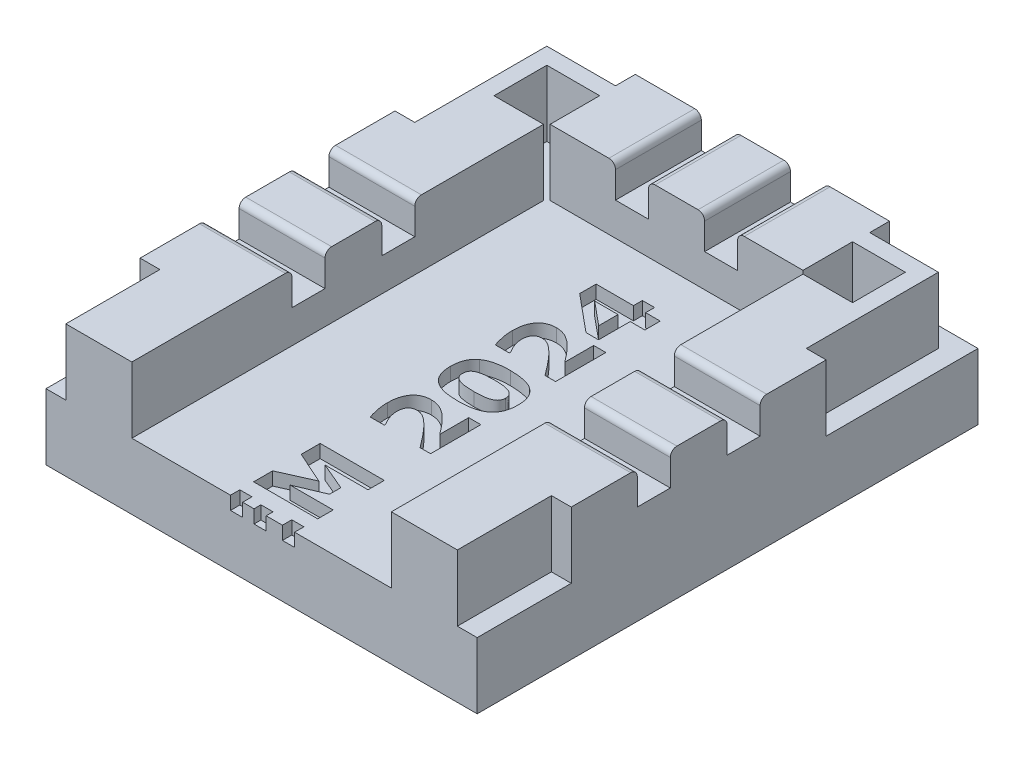
from build123d import *

# Parameters (mm, degrees)
SKETCH1_W                                  = 240
SKETCH1_H                                  = 200
BOSS_EXTRUDE1_DEPTH                        = 20
SKETCH7_W                                  = 120
SKETCH7_H                                  = 50
BOSS_EXTRUDE6_DEPTH                        = 20
FILLET1_R                                  = 2
SKETCH2_W                                  = 39.3
SKETCH2_H                                  = 125.7
CUT_EXTRUDE1_DEPTH                         = 10
CUT_EXTRUDE3_DEPTH                         = 5
MIRROR4_AT_THE_SECOND_PLANE_COPY_1_DEPTH   = 5
SKETCH11_W                                 = 104.748042719
SKETCH11_H                                 = 5
CUT_EXTRUDE4_DEPTH                         = 5
MIRROR6_AT_THE_SECOND_PLANE_COPY_1_SKETC_W = 104.748042719
MIRROR6_AT_THE_SECOND_PLANE_COPY_1_SKETC_H = 5
MIRROR6_AT_THE_SECOND_PLANE_COPY_1_DEPTH   = 5
SHELL1_START                               = 10
SHELL1_OUTLINE_W                           = 80.35
SHELL1_OUTLINE_H                           = 28.5
SHELL1_DEPTH                               = 10
FILLET3_R                                  = 1
SKETCH13_W                                 = 7.252545243
SKETCH13_H                                 = 2.335565418
SKETCH13_W_2                               = 1.720942939
SKETCH13_H_2                               = 2.581414408
CUT_EXTRUDE5_DEPTH                         = 2
CUT_EXTRUDE6_DEPTH                         = 10
MIRROR7_AT_THE_SECOND_PLANE_COPY_1_DEPTH   = 10
SKETCH15_W                                 = 101.789001661
SKETCH15_H                                 = 87.14110882
CUT_EXTRUDE7_DEPTH                         = 194.132079158
SKETCH16_W                                 = 296.201154453
SKETCH16_H                                 = 328.833485028
SKETCH16_W_2                               = 65.3
SKETCH16_H_2                               = 151.7
CUT_EXTRUDE10_DEPTH                        = 194.132079158
SKETCH17_W                                 = 70.628428311
SKETCH17_H                                 = 22.805656891
CUT_EXTRUDE12_DEPTH                        = 85.966140315


# Read off the part's stored shape, not the designer's step: Shell1
with BuildPart() as part:
    # Sketch1 → Boss-Extrude1 (new body)
    with BuildSketch(Plane(origin=(0, 0, 0), x_dir=(1, 0, 0), z_dir=(0, 1, 0))):
        Rectangle(SKETCH1_W, SKETCH1_H)
    extrude(amount=BOSS_EXTRUDE1_DEPTH)

    # Sketch7 → Boss-Extrude6 (add)
    with BuildSketch(Plane(origin=(0, 0, 0), x_dir=(1, 0, 0), z_dir=(0, 1, 0))):
        with Locations((0, 125)):
            Rectangle(SKETCH7_W, SKETCH7_H)
        with Locations((0, -125)):
            Rectangle(SKETCH7_W, SKETCH7_H)
    extrude(amount=BOSS_EXTRUDE6_DEPTH)

    # Fillet1
    fillet1_edges = [part.edges().sort_by_distance(p)[0] for p in [
        (-120, 20, 0),
        (90, 20, 100),
        (-90, 20, 100),
        (-60, 10, 150),
        (60, 10, 150),
        (-60, 20, 125),
        (0, 20, 150),
        (60, 20, 125),
        (-90, 20, -100),
        (60, 20, -125),
        (0, 20, -150),
        (60, 10, -150),
        (-60, 10, -150),
        (-60, 20, -125),
        (120, 20, 0),
        (120, 10, 100),
        (-120, 10, 100),
        (-120, 10, -100),
        (120, 10, -100),
        (90, 20, -100),
    ]]
    fillet(fillet1_edges, radius=FILLET1_R)

    # Sketch2 → Cut-Extrude1 (cut)
    with BuildSketch(Plane(origin=(0, 20, 0), x_dir=(1, 0, 0), z_dir=(0, 1, 0))):
        Rectangle(SKETCH2_W, SKETCH2_H)
    extrude(amount=-CUT_EXTRUDE1_DEPTH, mode=Mode.SUBTRACT)

    # Sketch10 → Cut-Extrude3 (cut)
    with BuildSketch(Plane(origin=(0, 20, 0), x_dir=(1, 0, 0), z_dir=(0, 1, 0))):
        Polygon((-9.25, -40.5), (-9.25, -33.162899401), (-4.25, -33.162899401), (-4.25, -40.5), (-4.25, -156.832928994), (-9.25, -156.832928994), align=None)
    cut_extrude3 = extrude(amount=-CUT_EXTRUDE3_DEPTH, mode=Mode.SUBTRACT)

    # Mirror4: Cut-Extrude3 across plane
    add(cut_extrude3.mirror(Plane(origin=(0, 0, 0), x_dir=(0, 0, 1), z_dir=(1, 0, 0))), mode=Mode.SUBTRACT)

    # Mirror4 at the second plane: Cut-Extrude3 across plane
    add(cut_extrude3.mirror(Plane.XY), mode=Mode.SUBTRACT)

    # Mirror4 at the second plane copy 1 sketc → Mirror4 at the second plane copy 1 (cut)
    with BuildSketch(Plane(origin=(0, 20, 0), x_dir=(-1, 0, 0), z_dir=(0, 1, 0))):
        Polygon((-9.25, -40.5), (-9.25, -33.162899401), (-4.25, -33.162899401), (-4.25, -40.5), (-4.25, -156.832928994), (-9.25, -156.832928994), align=None)
    extrude(amount=-MIRROR4_AT_THE_SECOND_PLANE_COPY_1_DEPTH, mode=Mode.SUBTRACT)

    # Sketch11 → Cut-Extrude4 (cut)
    with BuildSketch(Plane(origin=(0, 20, 0), x_dir=(1, 0, 0), z_dir=(0, 1, 0))):
        with Locations((-72.024021359, 26.75)):
            Rectangle(SKETCH11_W, SKETCH11_H)
        with Locations((-72.024021359, 40.35)):
            Rectangle(SKETCH11_W, SKETCH11_H)
    cut_extrude4 = extrude(amount=-CUT_EXTRUDE4_DEPTH, mode=Mode.SUBTRACT)

    # Mirror6: Cut-Extrude4 across plane
    add(cut_extrude4.mirror(Plane.XY), mode=Mode.SUBTRACT)

    # Mirror6 at the second plane: Cut-Extrude4 across plane
    add(cut_extrude4.mirror(Plane(origin=(0, 0, 0), x_dir=(0, 0, 1), z_dir=(1, 0, 0))), mode=Mode.SUBTRACT)

    # Mirror6 at the second plane copy 1 sketc → Mirror6 at the second plane copy 1 (cut)
    with BuildSketch(Plane(origin=(0, 20, 0), x_dir=(-1, 0, 0), z_dir=(0, 1, 0))):
        with Locations((-72.024021359, 26.75)):
            Rectangle(MIRROR6_AT_THE_SECOND_PLANE_COPY_1_SKETC_W, MIRROR6_AT_THE_SECOND_PLANE_COPY_1_SKETC_H)
        with Locations((-72.024021359, 40.35)):
            Rectangle(MIRROR6_AT_THE_SECOND_PLANE_COPY_1_SKETC_W, MIRROR6_AT_THE_SECOND_PLANE_COPY_1_SKETC_H)
    extrude(amount=-MIRROR6_AT_THE_SECOND_PLANE_COPY_1_DEPTH, mode=Mode.SUBTRACT)

    # Shell1 outline → Shell1 (cut)
    with BuildSketch(Plane(origin=(0, 0, 0), x_dir=(1, 0, 0), z_dir=(0, 1, 0)).offset(SHELL1_START)):
        Polygon((-29.65, 72.85), (-19.25, 72.85), (-19.25, 140), (-50, 140), (-50, 90), (-110, 90), (-110, 52.85), (-29.65, 52.85), align=None)
        Polygon((19.25, 72.85), (29.65, 72.85), (29.65, 52.85), (110, 52.85), (110, 90), (50, 90), (50, 140), (19.25, 140), align=None)
        Polygon((-110, -52.85), (-110, -90), (-50, -90), (-50, -140), (-19.25, -140), (-19.25, -72.85), (-29.65, -72.85), (-29.65, -52.85), align=None)
        with Locations((-69.825, 0)):
            Rectangle(SHELL1_OUTLINE_W, SHELL1_OUTLINE_H)
        Polygon((29.65, -72.85), (19.25, -72.85), (19.25, -140), (50, -140), (50, -90), (110, -90), (110, -52.85), (29.65, -52.85), align=None)
        with Locations((69.825, 0)):
            Rectangle(SHELL1_OUTLINE_W, SHELL1_OUTLINE_H)
    extrude(amount=SHELL1_DEPTH, mode=Mode.SUBTRACT)

    # Fillet3
    fillet3_edges = [part.edges().sort_by_distance(p)[0] for p in [
        (-4.25, 16.5, 150),
        (-4.25, 19.414213562, 149.414213562),
        (-9.25, 16.5, 150),
        (-9.25, 19.414213562, 149.414213562),
        (-4.25, 20, 105.425),
        (-9.25, 20, 105.425),
        (-9.25, 19.414213562, -149.414213562),
        (-9.25, 16.5, -150),
        (-9.25, 20, -105.425),
        (-4.25, 16.5, -150),
        (-4.25, 19.414213562, -149.414213562),
        (-4.25, 20, -105.425),
        (9.25, 16.5, 150),
        (9.25, 20, 105.425),
        (9.25, 19.414213562, 149.414213562),
        (4.25, 16.5, 150),
        (4.25, 19.414213562, 149.414213562),
        (4.25, 20, 105.425),
        (4.25, 16.5, -150),
        (4.25, 19.414213562, -149.414213562),
        (9.25, 19.414213562, -149.414213562),
        (9.25, 16.5, -150),
        (4.25, 20, -105.425),
        (9.25, 20, -105.425),
        (-120, 16.5, -24.25),
        (-120, 16.5, -29.25),
        (-119.414213562, 19.414213562, -24.25),
        (-119.414213562, 19.414213562, -29.25),
        (-68.825, 20, -24.25),
        (-68.825, 20, -29.25),
        (-120, 16.5, -37.85),
        (-120, 16.5, -42.85),
        (-68.825, 20, -37.85),
        (-68.825, 20, -42.85),
        (-119.414213562, 19.414213562, -37.85),
        (-119.414213562, 19.414213562, -42.85),
        (68.825, 20, -29.25),
        (119.414213562, 19.414213562, -29.25),
        (119.414213562, 19.414213562, -24.25),
        (68.825, 20, -24.25),
        (120, 16.5, -29.25),
        (120, 16.5, -24.25),
        (68.825, 20, -42.85),
        (119.414213562, 19.414213562, -42.85),
        (119.414213562, 19.414213562, -37.85),
        (68.825, 20, -37.85),
        (120, 16.5, -42.85),
        (120, 16.5, -37.85),
        (-120, 16.5, 29.25),
        (-120, 16.5, 24.25),
        (-68.825, 20, 29.25),
        (-119.414213562, 19.414213562, 29.25),
        (-119.414213562, 19.414213562, 24.25),
        (-68.825, 20, 24.25),
        (-120, 16.5, 42.85),
        (-120, 16.5, 37.85),
        (-68.825, 20, 42.85),
        (-119.414213562, 19.414213562, 42.85),
        (-119.414213562, 19.414213562, 37.85),
        (-68.825, 20, 37.85),
        (120, 16.5, 24.25),
        (120, 16.5, 29.25),
        (119.414213562, 19.414213562, 24.25),
        (119.414213562, 19.414213562, 29.25),
        (68.825, 20, 24.25),
        (68.825, 20, 29.25),
        (120, 16.5, 37.85),
        (120, 16.5, 42.85),
        (68.825, 20, 37.85),
        (68.825, 20, 42.85),
        (119.414213562, 19.414213562, 37.85),
        (119.414213562, 19.414213562, 42.85),
    ]]
    fillet(fillet3_edges, radius=FILLET3_R)

    # Sketch13 → Cut-Extrude5 (cut)
    # profile 1 of 12: a face of its own
    with BuildSketch(Plane(origin=(0, 10, 0), x_dir=(1, 0, 0), z_dir=(0, 1, 0))):
        Polygon((2.787359078, 56.729654742), (2.787359078, 55.37748529), (5, 55.37748529), (5, 53.041919872), (2.787359078, 53.041919872), (2.787359078, 48.247864542), (0.880108701, 48.247864542), (-4.711035156, 52.886343558), (-4.711035156, 55.37748529), (0.943491644, 55.37748529), (0.943491644, 56.729654742), align=None)
        Polygon((0.943491644, 53.041919872), (-2.596349692, 53.041919872), (0.943491644, 50.110938929), align=None, mode=Mode.SUBTRACT)
    # profile 2 of 12: a face of its own
    with BuildSketch(Plane(origin=(0, 10, 0), x_dir=(1, 0, 0), z_dir=(0, 1, 0))):
        with BuildLine():
            Line((5, 47.141544081), (5, 39.520225351))
            Line((5, 39.520225351), (3.409664338, 39.520225351))
            add(Edge.make_bspline(
                [(3.409664338, 39.520225351), (3.190599668, 39.81675512), (2.747057383, 40.417141716), (2.167094132, 41.14339637), (1.704390868, 41.703253096), (1.381972101, 42.083056551), (1.083256561, 42.417759603), (0.887687077, 42.622007507), (0.79559811, 42.718182933)],
                knots=[0, 0, 0, 0, 1.605452287, 3.25057426, 4.046675402, 4.768563423, 5.420146126, 6, 6, 6, 6], degree=3))
            add(Edge.make_bspline(
                [(0.79559811, 42.718182933), (0.732570292, 42.782561984), (0.609352585, 42.908421315), (0.423765416, 43.085974145), (0.244476812, 43.249198615), (0.074088064, 43.400664381), (-0.092796487, 43.534082219), (-0.252790737, 43.654099684), (-0.406497488, 43.759962438), (-0.599845109, 43.881290453), (-0.837875375, 44.00401532), (-1.125540586, 44.112139625), (-1.412736444, 44.178491494), (-1.604945873, 44.187117789), (-1.699385013, 44.191356186)],
                knots=[0, 0, 0, 0, 1.090093853, 2.131104457, 3.107135244, 4.023908394, 4.888948297, 5.691514549, 6.4435893, 7.146498757, 8.452673016, 9.675803408, 10.85804184, 12, 12, 12, 12], degree=3))
            add(Edge.make_bspline(
                [(-1.699385013, 44.191356186), (-1.754483363, 44.189605987), (-1.861179083, 44.186216799), (-2.017224671, 44.167846758), (-2.162681909, 44.132103765), (-2.300488192, 44.087839319), (-2.42643972, 44.024206924), (-2.544199113, 43.950411254), (-2.650531499, 43.859818439), (-2.749307162, 43.758726543), (-2.834556733, 43.642742478), (-2.911599654, 43.517157005), (-2.971430142, 43.377241787), (-3.024398474, 43.226819474), (-3.063653395, 43.063897589), (-3.092633036, 42.889340485), (-3.109905835, 42.703165878), (-3.111960528, 42.574807759), (-3.113016713, 42.508827152)],
                knots=[0, 0, 0, 0, 1.058578686, 2.049894692, 3.010224385, 3.931750511, 4.822578239, 5.71281177, 6.594427321, 7.498813824, 8.420995957, 9.353043897, 10.321837571, 11.3367408, 12.413304787, 13.535187771, 14.732999458, 16, 16, 16, 16], degree=3))
            add(Edge.make_bspline(
                [(-3.113016713, 42.508827152), (-3.110052719, 42.405568465), (-3.104041103, 42.196137688), (-3.053985994, 41.878413923), (-2.980602684, 41.552282773), (-2.873221808, 41.222921491), (-2.74714341, 40.895094854), (-2.596251992, 40.578640505), (-2.438170844, 40.269132893), (-2.314289691, 40.074405983), (-2.252545243, 39.977350819)],
                knots=[0, 0, 0, 0, 0.914703558, 1.855215137, 2.844920106, 3.875005138, 4.922433174, 5.955639304, 6.981056277, 8, 8, 8, 8], degree=3))
            Line((-2.252545243, 39.977350819), (-2.252545243, 39.766074342))
            Line((-2.252545243, 39.766074342), (-4.363389317, 39.766074342))
            add(Edge.make_bspline(
                [(-4.363389317, 39.766074342), (-4.396975153, 39.85152697), (-4.470639347, 40.038951181), (-4.568658946, 40.352153969), (-4.66491051, 40.720660415), (-4.763825821, 41.132864511), (-4.849735205, 41.573321973), (-4.910075419, 42.024211578), (-4.95119256, 42.474770211), (-4.954991729, 42.775713815), (-4.956884148, 42.92561802)],
                knots=[0, 0, 0, 0, 0.681686624, 1.495150967, 2.435076171, 3.509887788, 4.642826517, 5.765734475, 6.887081194, 8, 8, 8, 8], degree=3))
            add(Edge.make_bspline(
                [(-4.956884148, 42.92561802), (-4.954912362, 43.072306092), (-4.951074185, 43.357841566), (-4.914531776, 43.772464491), (-4.853049644, 44.160650299), (-4.769612134, 44.521836328), (-4.662431161, 44.856562797), (-4.529987596, 45.163893905), (-4.371768891, 45.443672956), (-4.191325, 45.69718541), (-3.986517109, 45.920499957), (-3.762299213, 46.116633841), (-3.516918106, 46.283180062), (-3.250583577, 46.417510178), (-2.964907945, 46.521931142), (-2.659732708, 46.596780352), (-2.333869778, 46.641015432), (-2.109911454, 46.646854566), (-1.995172081, 46.649846099)],
                knots=[0, 0, 0, 0, 1.302669921, 2.535710425, 3.693104205, 4.791067539, 5.825099944, 6.810730835, 7.758000335, 8.67487823, 9.568447078, 10.443087854, 11.315285082, 12.19521531, 13.085757283, 14.011200708, 14.981089066, 16, 16, 16, 16], degree=3))
            add(Edge.make_bspline(
                [(-1.995172081, 46.649846099), (-1.918295051, 46.648245135), (-1.764899121, 46.645050664), (-1.536586701, 46.623146341), (-1.311198259, 46.589276583), (-1.089189633, 46.538876948), (-0.870129482, 46.472993238), (-0.653296175, 46.39436831), (-0.439122967, 46.302496277), (-0.229338943, 46.193054838), (-0.018163961, 46.072147599), (0.191952814, 45.932794317), (0.405837655, 45.781094454), (0.620958688, 45.614342324), (0.835471411, 45.430057751), (1.055741697, 45.23549192), (1.273520634, 45.021368665), (1.417594688, 44.872241147), (1.490889788, 44.796375188)],
                knots=[0, 0, 0, 0, 0.907170522, 1.810115022, 2.704515666, 3.595334857, 4.494160497, 5.402400165, 6.316123003, 7.242010315, 8.19323076, 9.186549597, 10.215937183, 11.28746875, 12.397107329, 13.552885457, 14.755074217, 16, 16, 16, 16], degree=3))
            add(Edge.make_bspline(
                [(1.490889788, 44.796375188), (1.669671754, 44.600991906), (2.021428479, 44.216571794), (2.422503942, 43.720261203), (2.710127438, 43.347225494), (2.892573427, 43.11547907), (3.035611297, 42.923413887), (3.11966375, 42.809753418), (3.156132565, 42.760438229)],
                knots=[0, 0, 0, 0, 1.811045763, 3.563265038, 4.362127914, 5.033096026, 5.580478129, 6, 6, 6, 6], degree=3))
            Line((3.156132565, 42.760438229), (3.156132565, 47.141544081))
            Line((3.156132565, 47.141544081), (5, 47.141544081))
        make_face()
    # profile 3 of 12: a face of its own
    with BuildSketch(Plane(origin=(0, 10, 0), x_dir=(1, 0, 0), z_dir=(0, 1, 0))):
        with BuildLine():
            add(Edge.make_bspline(
                [(0.138720336, 37.553433421), (0.339837036, 37.551198694), (0.731017162, 37.546852061), (1.301575539, 37.503210957), (1.839727263, 37.435290008), (2.344336806, 37.340402007), (2.812295891, 37.218717557), (3.235819492, 37.059739443), (3.620265586, 36.877229499), (3.845547684, 36.720963882), (3.955141787, 36.64494457)],
                knots=[0, 0, 0, 0, 1.210994604, 2.355433537, 3.443919748, 4.476135166, 5.446013627, 6.351277171, 7.197937607, 8, 8, 8, 8], degree=3))
            add(Edge.make_bspline(
                [(3.955141787, 36.64494457), (4.057367971, 36.5617232), (4.260610648, 36.396265258), (4.524020765, 36.101981434), (4.745368417, 35.772676286), (4.897303004, 35.472877401), (4.999247268, 35.217133399), (5.063592063, 35.011802969), (5.122267484, 34.796985151), (5.167723638, 34.570405454), (5.201934481, 34.333084121), (5.226664862, 34.085073274), (5.242295446, 33.825562266), (5.244648027, 33.648682389), (5.245848991, 33.558387312)],
                knots=[0, 0, 0, 0, 1.363120718, 2.710110989, 4.070537742, 5.460816644, 6.180869889, 6.918733188, 7.687278466, 8.485437086, 9.309407483, 10.168795045, 11.065191617, 12, 12, 12, 12], degree=3))
            add(Edge.make_bspline(
                [(5.245848991, 33.558387312), (5.241905689, 33.384062955), (5.234297073, 33.047703496), (5.173081199, 32.562988904), (5.069699732, 32.118069919), (4.926806373, 31.711596248), (4.739854178, 31.34454147), (4.516760058, 31.013155063), (4.251279595, 30.717979546), (4.045332533, 30.554230832), (3.94169692, 30.471830054)],
                knots=[0, 0, 0, 0, 1.200851745, 2.317047666, 3.359233085, 4.342911255, 5.278031965, 6.189548012, 7.088953741, 8, 8, 8, 8], degree=3))
            add(Edge.make_bspline(
                [(3.94169692, 30.471830054), (3.829424185, 30.3947628), (3.600170882, 30.2373967), (3.214838014, 30.049115343), (2.792701976, 29.89168932), (2.331256748, 29.768085058), (1.834031119, 29.675388633), (1.301418942, 29.61187027), (0.734794995, 29.570336966), (0.344952566, 29.565716964), (0.144482422, 29.563341204)],
                knots=[0, 0, 0, 0, 0.822750793, 1.680001256, 2.58557045, 3.544707477, 4.565467581, 5.642347189, 6.787615291, 8, 8, 8, 8], degree=3))
            add(Edge.make_bspline(
                [(0.144482422, 29.563341204), (-0.061754837, 29.565532126), (-0.459970452, 29.569762495), (-1.036345286, 29.613069323), (-1.570746564, 29.680774054), (-2.065452333, 29.775711056), (-2.521358164, 29.900947264), (-2.938473361, 30.06222162), (-3.323134476, 30.249194002), (-3.55325365, 30.406272972), (-3.666176943, 30.483354226)],
                knots=[0, 0, 0, 0, 1.242237956, 2.39858964, 3.479780431, 4.485821505, 5.430991799, 6.32348679, 7.177307181, 8, 8, 8, 8], degree=3))
            add(Edge.make_bspline(
                [(-3.666176943, 30.483354226), (-3.769193286, 30.566416838), (-3.974708441, 30.732124775), (-4.238285133, 31.029639616), (-4.461065672, 31.362253167), (-4.645070962, 31.729678272), (-4.784115122, 32.135791847), (-4.885860052, 32.577168574), (-4.944671996, 33.056148657), (-4.952723667, 33.387282789), (-4.956884148, 33.558387312)],
                knots=[0, 0, 0, 0, 0.915406887, 1.826214983, 2.74012738, 3.682217607, 4.664024873, 5.706462388, 6.814877053, 8, 8, 8, 8], degree=3))
            add(Edge.make_bspline(
                [(-4.956884148, 33.558387312), (-4.955682618, 33.64868302), (-4.953320425, 33.826203271), (-4.937576888, 34.086978277), (-4.913381513, 34.337057391), (-4.877300412, 34.575699285), (-4.828262853, 34.80214551), (-4.773499009, 35.018778584), (-4.706561244, 35.224310597), (-4.601886899, 35.480626422), (-4.447267393, 35.781827029), (-4.217150947, 36.109134402), (-3.948246131, 36.405401156), (-3.739143401, 36.569659884), (-3.633525124, 36.652627351)],
                knots=[0, 0, 0, 0, 0.927772364, 1.823989051, 2.683453821, 3.508702832, 4.302191287, 5.063276402, 5.803871599, 6.520953588, 7.906777029, 9.27188215, 10.622021304, 12, 12, 12, 12], degree=3))
            add(Edge.make_bspline(
                [(-3.633525124, 36.652627351), (-3.521300204, 36.729189524), (-3.292789343, 36.885084383), (-2.908970475, 37.068290297), (-2.492360426, 37.225455121), (-2.036263275, 37.346342452), (-1.54437137, 37.439204828), (-1.015826808, 37.505677425), (-0.450933502, 37.546286922), (-0.061742996, 37.551003841), (0.138720336, 37.553433421)],
                knots=[0, 0, 0, 0, 0.826423845, 1.682753026, 2.582377666, 3.535958882, 4.552416628, 5.629628825, 6.779074777, 8, 8, 8, 8], degree=3))
        make_face()
        with BuildLine():
            add(Edge.make_bspline(
                [(0.138720336, 35.094943508), (-0.002794049, 35.093990238), (-0.275052116, 35.092156251), (-0.667644343, 35.074004214), (-1.028464631, 35.048543297), (-1.357952356, 35.010483072), (-1.656192237, 34.961169576), (-1.923473104, 34.900935006), (-2.158488294, 34.828227196), (-2.363936988, 34.745989678), (-2.54162794, 34.64913888), (-2.69467252, 34.537908006), (-2.823572221, 34.410664927), (-2.931286275, 34.270097317), (-3.011274034, 34.111739825), (-3.072443859, 33.941187009), (-3.106785969, 33.754382189), (-3.110895684, 33.625106618), (-3.113016713, 33.558387312)],
                knots=[0, 0, 0, 0, 1.684598718, 3.240982106, 4.677870026, 5.990101975, 7.188004416, 8.275163324, 9.249099904, 10.113910365, 10.905306099, 11.652292794, 12.358339015, 13.054983843, 13.750418457, 14.461547751, 15.206002611, 16, 16, 16, 16], degree=3))
            add(Edge.make_bspline(
                [(-3.113016713, 33.558387312), (-3.110895681, 33.491668012), (-3.106785962, 33.362392453), (-3.072443884, 33.175587552), (-3.011273943, 33.005035023), (-2.931286606, 32.84667649), (-2.823570979, 32.706112772), (-2.694677343, 32.578854684), (-2.541608299, 32.467684345), (-2.363496496, 32.37029911), (-2.157013742, 32.289020864), (-1.921590867, 32.215742751), (-1.654258135, 32.155647372), (-1.355414385, 32.106122047), (-1.024612933, 32.068276855), (-0.661244964, 32.04269777), (-0.266085327, 32.024665897), (0.008090715, 32.022799039), (0.150244508, 32.021831116)],
                knots=[0, 0, 0, 0, 0.791766581, 1.534129826, 2.243261137, 2.936741863, 3.631429404, 4.335491923, 5.08037989, 5.869552125, 6.738971147, 7.710171362, 8.794275798, 9.988812621, 11.304907075, 12.745337551, 14.312534512, 16, 16, 16, 16], degree=3))
            add(Edge.make_bspline(
                [(0.150244508, 32.021831116), (0.289201434, 32.022765136), (0.556986265, 32.024565091), (0.943773412, 32.043063349), (1.30096878, 32.067483158), (1.627502144, 32.109075315), (1.924420257, 32.156514098), (2.190195476, 32.220950105), (2.427221865, 32.292197549), (2.635687527, 32.376524358), (2.816464841, 32.475577579), (2.974492505, 32.586386469), (3.106149375, 32.714997304), (3.215613674, 32.855867424), (3.298888327, 33.012083539), (3.358752163, 33.181622444), (3.396338685, 33.365314373), (3.400067537, 33.492898418), (3.401981557, 33.558387312)],
                knots=[0, 0, 0, 0, 1.658832269, 3.196746878, 4.622488866, 5.931787449, 7.125569234, 8.210133994, 9.194149195, 10.078471196, 10.889203548, 11.650697572, 12.375032472, 13.07829054, 13.77251817, 14.478471121, 15.218999177, 16, 16, 16, 16], degree=3))
            add(Edge.make_bspline(
                [(3.401981557, 33.558387312), (3.400068186, 33.623876875), (3.3963406, 33.751462223), (3.358745104, 33.935144911), (3.298913291, 34.10471679), (3.215521541, 34.260812329), (3.106775331, 34.40178813), (2.97377315, 34.528364287), (2.816557237, 34.639341559), (2.635707586, 34.738476019), (2.42683161, 34.821967534), (2.190341985, 34.897522561), (1.921851262, 34.956560743), (1.624132619, 35.009519497), (1.295502071, 35.045529443), (0.936895825, 35.074962985), (0.547988509, 35.091838226), (0.278306115, 35.093884415), (0.138720336, 35.094943508)],
                knots=[0, 0, 0, 0, 0.778971247, 1.517574904, 2.221693305, 2.914116855, 3.615547377, 4.332711038, 5.092226179, 5.900851692, 6.782875619, 7.766611013, 8.854037796, 10.053520173, 11.366075456, 12.788704916, 14.337855446, 16, 16, 16, 16], degree=3))
        make_face(mode=Mode.SUBTRACT)
    # profile 4 of 12: a face of its own
    with BuildSketch(Plane(origin=(0, 10, 0), x_dir=(1, 0, 0), z_dir=(0, 1, 0))):
        with BuildLine():
            Line((5, 28.211171751), (5, 20.589853021))
            Line((5, 20.589853021), (3.409664338, 20.589853021))
            add(Edge.make_bspline(
                [(3.409664338, 20.589853021), (3.190599668, 20.88638279), (2.747057383, 21.486769386), (2.167094132, 22.21302404), (1.704390868, 22.772880767), (1.381972101, 23.152684221), (1.083256561, 23.487387273), (0.887687077, 23.691635177), (0.79559811, 23.787810603)],
                knots=[0, 0, 0, 0, 1.605452287, 3.25057426, 4.046675402, 4.768563423, 5.420146126, 6, 6, 6, 6], degree=3))
            add(Edge.make_bspline(
                [(0.79559811, 23.787810603), (0.732570292, 23.852189654), (0.609352585, 23.978048985), (0.423765416, 24.155601815), (0.244476812, 24.318826285), (0.074088064, 24.470292051), (-0.092796487, 24.60370989), (-0.252790737, 24.723727355), (-0.406497488, 24.829590108), (-0.599845109, 24.950918123), (-0.837875375, 25.07364299), (-1.125540586, 25.181767295), (-1.412736444, 25.248119164), (-1.604945873, 25.256745459), (-1.699385013, 25.260983856)],
                knots=[0, 0, 0, 0, 1.090093853, 2.131104457, 3.107135244, 4.023908394, 4.888948297, 5.691514549, 6.4435893, 7.146498757, 8.452673016, 9.675803408, 10.85804184, 12, 12, 12, 12], degree=3))
            add(Edge.make_bspline(
                [(-1.699385013, 25.260983856), (-1.754483363, 25.259233658), (-1.861179083, 25.25584447), (-2.017224671, 25.237474428), (-2.162681909, 25.201731435), (-2.300488192, 25.157466989), (-2.42643972, 25.093834595), (-2.544199113, 25.020038924), (-2.650531499, 24.929446109), (-2.749307162, 24.828354213), (-2.834556733, 24.712370148), (-2.911599654, 24.586784675), (-2.971430142, 24.446869457), (-3.024398474, 24.296447144), (-3.063653395, 24.133525259), (-3.092633036, 23.958968155), (-3.109905835, 23.772793548), (-3.111960528, 23.644435429), (-3.113016713, 23.578454822)],
                knots=[0, 0, 0, 0, 1.058578686, 2.049894692, 3.010224385, 3.931750511, 4.822578239, 5.71281177, 6.594427321, 7.498813824, 8.420995957, 9.353043897, 10.321837571, 11.3367408, 12.413304787, 13.535187771, 14.732999458, 16, 16, 16, 16], degree=3))
            add(Edge.make_bspline(
                [(-3.113016713, 23.578454822), (-3.110052719, 23.475196136), (-3.104041103, 23.265765358), (-3.053985994, 22.948041593), (-2.980602684, 22.621910443), (-2.873221808, 22.292549161), (-2.74714341, 21.964722525), (-2.596251992, 21.648268175), (-2.438170844, 21.338760563), (-2.314289691, 21.144033653), (-2.252545243, 21.046978489)],
                knots=[0, 0, 0, 0, 0.914703558, 1.855215137, 2.844920106, 3.875005138, 4.922433174, 5.955639304, 6.981056277, 8, 8, 8, 8], degree=3))
            Line((-2.252545243, 21.046978489), (-2.252545243, 20.835702012))
            Line((-2.252545243, 20.835702012), (-4.363389317, 20.835702012))
            add(Edge.make_bspline(
                [(-4.363389317, 20.835702012), (-4.396975153, 20.92115464), (-4.470639347, 21.108578851), (-4.568658946, 21.421781639), (-4.66491051, 21.790288086), (-4.763825821, 22.202492181), (-4.849735205, 22.642949643), (-4.910075419, 23.093839248), (-4.95119256, 23.544397881), (-4.954991729, 23.845341485), (-4.956884148, 23.99524569)],
                knots=[0, 0, 0, 0, 0.681686624, 1.495150967, 2.435076171, 3.509887788, 4.642826517, 5.765734475, 6.887081194, 8, 8, 8, 8], degree=3))
            add(Edge.make_bspline(
                [(-4.956884148, 23.99524569), (-4.954912362, 24.141933762), (-4.951074185, 24.427469237), (-4.914531776, 24.842092162), (-4.853049644, 25.230277969), (-4.769612134, 25.591463998), (-4.662431161, 25.926190468), (-4.529987596, 26.233521576), (-4.371768891, 26.513300626), (-4.191325, 26.76681308), (-3.986517109, 26.990127627), (-3.762299213, 27.186261512), (-3.516918106, 27.352807733), (-3.250583577, 27.487137848), (-2.964907945, 27.591558812), (-2.659732708, 27.666408023), (-2.333869778, 27.710643103), (-2.109911454, 27.716482236), (-1.995172081, 27.719473769)],
                knots=[0, 0, 0, 0, 1.302669921, 2.535710425, 3.693104205, 4.791067539, 5.825099944, 6.810730835, 7.758000335, 8.67487823, 9.568447078, 10.443087854, 11.315285082, 12.19521531, 13.085757283, 14.011200708, 14.981089066, 16, 16, 16, 16], degree=3))
            add(Edge.make_bspline(
                [(-1.995172081, 27.719473769), (-1.918295051, 27.717872805), (-1.764899121, 27.714678334), (-1.536586701, 27.692774011), (-1.311198259, 27.658904253), (-1.089189633, 27.608504619), (-0.870129482, 27.542620908), (-0.653296175, 27.46399598), (-0.439122967, 27.372123947), (-0.229338943, 27.262682508), (-0.018163961, 27.141775269), (0.191952814, 27.002421987), (0.405837655, 26.850722124), (0.620958688, 26.683969994), (0.835471411, 26.499685422), (1.055741697, 26.30511959), (1.273520634, 26.090996335), (1.417594688, 25.941868817), (1.490889788, 25.866002858)],
                knots=[0, 0, 0, 0, 0.907170522, 1.810115022, 2.704515666, 3.595334857, 4.494160497, 5.402400165, 6.316123003, 7.242010315, 8.19323076, 9.186549597, 10.215937183, 11.28746875, 12.397107329, 13.552885457, 14.755074217, 16, 16, 16, 16], degree=3))
            add(Edge.make_bspline(
                [(1.490889788, 25.866002858), (1.669671754, 25.670619576), (2.021428479, 25.286199464), (2.422503942, 24.789888873), (2.710127438, 24.416853164), (2.892573427, 24.18510674), (3.035611297, 23.993041557), (3.11966375, 23.879381088), (3.156132565, 23.830065899)],
                knots=[0, 0, 0, 0, 1.811045763, 3.563265038, 4.362127914, 5.033096026, 5.580478129, 6, 6, 6, 6], degree=3))
            Line((3.156132565, 23.830065899), (3.156132565, 28.211171751))
            Line((3.156132565, 28.211171751), (5, 28.211171751))
        make_face()
    # profile 5 of 12: a face of its own
    with BuildSketch(Plane(origin=(0, 10, 0), x_dir=(1, 0, 0), z_dir=(0, 1, 0))):
        Polygon((5, 13.583156769), (5, 11.124666856), (-1.524601746, 11.124666856), (2.664434583, 9.338420279), (2.664434583, 7.625160121), (-1.524601746, 5.838913543), (5, 5.838913543), (5, 3.503348126), (-4.711035156, 3.503348126), (-4.711035156, 6.382470298), (0.125275469, 8.549014533), (-4.711035156, 10.709796683), (-4.711035156, 13.583156769), align=None)
    # profile 6 of 12: a face of its own
    with BuildSketch(Plane(origin=(0, 10, 0), x_dir=(1, 0, 0), z_dir=(0, 1, 0))):
        Polygon((5, 1.4136317), (5, -5.593064552), (-4.711035156, -5.593064552), (-4.711035156, 1.4136317), (-2.867167722, 1.4136317), (-2.867167722, -3.134574639), (-1.146224782, -3.134574639), (-1.146224782, 1.044858213), (0.697642652, 1.044858213), (0.697642652, -3.134574639), (3.156132565, -3.134574639), (3.156132565, 1.4136317), align=None)
    # profile 7 of 12: a face of its own
    with BuildSketch(Plane(origin=(0, 10, 0), x_dir=(1, 0, 0), z_dir=(0, 1, 0))):
        with BuildLine():
            add(Edge.make_bspline(
                [(4.475650198, -7.805705474), (4.519354839, -7.923859504), (4.612512661, -8.17570855), (4.743574124, -8.583890089), (4.866671289, -9.047274178), (4.996208031, -9.552124696), (5.106381276, -10.084227717), (5.187397941, -10.625264318), (5.237323662, -11.165972628), (5.243010567, -11.526628491), (5.245848991, -11.706637515)],
                knots=[0, 0, 0, 0, 0.756485239, 1.612472169, 2.573171414, 3.635272123, 4.742182008, 5.834553763, 6.919191659, 8, 8, 8, 8], degree=3))
            add(Edge.make_bspline(
                [(5.245848991, -11.706637515), (5.241962961, -11.909112321), (5.234392087, -12.303579456), (5.17063924, -12.878829296), (5.062937634, -13.419584917), (4.916847086, -13.928231287), (4.72267015, -14.400885619), (4.491042888, -14.842463027), (4.211679163, -15.247896521), (3.893490591, -15.618759753), (3.53655883, -15.9505899), (3.145758166, -16.239699566), (2.72146993, -16.48347792), (2.264846611, -16.681095463), (1.776896349, -16.838089964), (1.255150105, -16.944841813), (0.702111097, -17.014888699), (0.322052776, -17.021601157), (0.127196165, -17.025042647)],
                knots=[0, 0, 0, 0, 1.160705024, 2.261318311, 3.313123859, 4.319096107, 5.290496718, 6.238021168, 7.172737693, 8.107230733, 9.03451477, 9.961071912, 10.888559376, 11.833805606, 12.808979065, 13.821966168, 14.883317984, 16, 16, 16, 16], degree=3))
            add(Edge.make_bspline(
                [(0.127196165, -17.025042647), (-0.058682323, -17.02067815), (-0.422730133, -17.012130168), (-0.955049114, -16.943336637), (-1.460067022, -16.832867692), (-1.937766829, -16.677677821), (-2.386372436, -16.473696921), (-2.808700267, -16.227656485), (-3.203463564, -15.935836699), (-3.565000576, -15.598836264), (-3.895700628, -15.226075236), (-4.177610929, -14.810267907), (-4.422741814, -14.363406013), (-4.616779655, -13.8775432), (-4.772219277, -13.359136807), (-4.876169413, -12.804694831), (-4.946971316, -12.216810998), (-4.953520434, -11.812500101), (-4.956884148, -11.604840667)],
                knots=[0, 0, 0, 0, 1.061573339, 2.079118747, 3.060574866, 4.011305467, 4.942696719, 5.870461571, 6.798745348, 7.740825567, 8.68941507, 9.638984161, 10.604583371, 11.595514188, 12.621960228, 13.691449096, 14.814297672, 16, 16, 16, 16], degree=3))
            add(Edge.make_bspline(
                [(-4.956884148, -11.604840667), (-4.954318925, -11.445386322), (-4.949235323, -11.129389392), (-4.919388643, -10.661251886), (-4.863951384, -10.205248288), (-4.792453594, -9.753475749), (-4.684946461, -9.294730481), (-4.534849919, -8.818874824), (-4.346707534, -8.316660693), (-4.193287983, -7.980233106), (-4.113698935, -7.805705474)],
                knots=[0, 0, 0, 0, 0.974479143, 1.931163549, 2.86485946, 3.780778834, 4.725046501, 5.741022375, 6.828116267, 8, 8, 8, 8], degree=3))
            Line((-4.113698935, -7.805705474), (-1.883771756, -7.805705474))
            Line((-1.883771756, -7.805705474), (-1.883771756, -8.091889065))
            add(Edge.make_bspline(
                [(-1.883771756, -8.091889065), (-1.906716104, -8.126531064), (-1.957410079, -8.203070203), (-2.043059993, -8.326945943), (-2.137489474, -8.476111594), (-2.284548962, -8.694884397), (-2.45960062, -8.978067997), (-2.581693909, -9.213466955), (-2.640525683, -9.326896107)],
                knots=[0, 0, 0, 0, 0.515980687, 1.140024195, 1.869947604, 2.707876564, 4.413660046, 6, 6, 6, 6], degree=3))
            add(Edge.make_bspline(
                [(-2.640525683, -9.326896107), (-2.672756546, -9.393740863), (-2.73882048, -9.530753251), (-2.823836627, -9.749019276), (-2.905177649, -9.981830174), (-2.978097, -10.22950925), (-3.037034138, -10.489919732), (-3.082413494, -10.759686706), (-3.106467195, -11.03779789), (-3.110821171, -11.225783758), (-3.113016713, -11.320577771)],
                knots=[0, 0, 0, 0, 0.861448091, 1.765719082, 2.717953576, 3.724891765, 4.761927522, 5.816719679, 6.89905606, 8, 8, 8, 8], degree=3))
            add(Edge.make_bspline(
                [(-3.113016713, -11.320577771), (-3.110164997, -11.430782772), (-3.104578279, -11.646682304), (-3.068710383, -11.963218824), (-3.004292393, -12.263584213), (-2.918860854, -12.549882667), (-2.805175217, -12.820581595), (-2.662381265, -13.075068024), (-2.499039638, -13.320076357), (-2.36711736, -13.466852812), (-2.300562624, -13.540901474)],
                knots=[0, 0, 0, 0, 1.091217493, 2.137773647, 3.148547478, 4.129133693, 5.092188092, 6.048375109, 7.015406034, 8, 8, 8, 8], degree=3))
            add(Edge.make_bspline(
                [(-2.300562624, -13.540901474), (-2.231129169, -13.608753509), (-2.090799964, -13.745886571), (-1.846186727, -13.91943259), (-1.579009792, -14.07619004), (-1.283734201, -14.208811415), (-0.962723927, -14.314570988), (-0.616833633, -14.387928819), (-0.248028071, -14.435679856), (0.006035391, -14.440927383), (0.136799641, -14.443628239)],
                knots=[0, 0, 0, 0, 0.871242595, 1.760833901, 2.686460846, 3.652134751, 4.663748384, 5.717797841, 6.825370436, 8, 8, 8, 8], degree=3))
            add(Edge.make_bspline(
                [(0.136799641, -14.443628239), (0.270078203, -14.441217619), (0.528956778, -14.436535262), (0.904701948, -14.395518364), (1.257245759, -14.329288021), (1.585144219, -14.233472949), (1.889752999, -14.11198958), (2.170660406, -13.964565335), (2.424839249, -13.78559248), (2.657673098, -13.584235453), (2.862193118, -13.352834409), (3.041867765, -13.096983341), (3.191530728, -12.813783401), (3.315763592, -12.506455713), (3.407777269, -12.172177215), (3.477785429, -11.813452581), (3.51753353, -11.428392977), (3.522401475, -11.163169785), (3.524906052, -11.026711399)],
                knots=[0, 0, 0, 0, 1.162877018, 2.258757441, 3.29433279, 4.289818334, 5.235063129, 6.152415668, 7.05144509, 7.94239879, 8.832861761, 9.739671241, 10.664582224, 11.622279774, 12.626959197, 13.685538709, 14.809200461, 16, 16, 16, 16], degree=3))
            add(Edge.make_bspline(
                [(3.524906052, -11.026711399), (3.524545414, -10.976125561), (3.523787414, -10.869802624), (3.51698298, -10.707868976), (3.511542352, -10.544994826), (3.50110347, -10.438303115), (3.496095624, -10.387119882)],
                knots=[0, 0, 0, 0, 0.947728294, 1.991965744, 3.036685378, 4, 4, 4, 4], degree=3))
            Line((3.496095624, -10.387119882), (1.435189626, -10.387119882))
            Line((1.435189626, -10.387119882), (1.435189626, -12.353911813))
            Line((1.435189626, -12.353911813), (-0.408677809, -12.353911813))
            Line((-0.408677809, -12.353911813), (-0.408677809, -7.805705474))
            Line((-0.408677809, -7.805705474), (4.475650198, -7.805705474))
        make_face()
    # profile 8 of 12: a face of its own
    with BuildSketch(Plane(origin=(0, 10, 0), x_dir=(1, 0, 0), z_dir=(0, 1, 0))):
        with Locations((1.373727378, -19.913768295)):
            Rectangle(SKETCH13_W, SKETCH13_H)
    # profile 9 of 12: a face of its own
    with BuildSketch(Plane(origin=(0, 10, 0), x_dir=(1, 0, 0), z_dir=(0, 1, 0))):
        with Locations((-4.219337174, -19.913768295)):
            Rectangle(SKETCH13_W_2, SKETCH13_H_2)
    # profile 10 of 12: a face of its own
    with BuildSketch(Plane(origin=(0, 10, 0), x_dir=(1, 0, 0), z_dir=(0, 1, 0))):
        with BuildLine():
            add(Edge.make_bspline(
                [(5.245848991, -30.773379208), (5.241556228, -30.949600555), (5.233101922, -31.296656552), (5.17328717, -31.807137753), (5.071443943, -32.296870987), (4.929457053, -32.76358831), (4.750483589, -33.205121013), (4.527408056, -33.614715808), (4.267338932, -33.994815031), (4.061606502, -34.220067298), (3.958983177, -34.332427496)],
                knots=[0, 0, 0, 0, 1.089850102, 2.146385891, 3.173869964, 4.179760968, 5.160008291, 6.115072822, 7.059761785, 8, 8, 8, 8], degree=3))
            add(Edge.make_bspline(
                [(3.958983177, -34.332427496), (3.848038568, -34.438295465), (3.624492228, -34.651612698), (3.240912088, -34.92404395), (2.819806379, -35.161121156), (2.440058042, -35.326067869), (2.118408243, -35.437370727), (1.865302565, -35.510926057), (1.602961267, -35.571890876), (1.331038558, -35.621175666), (1.050675199, -35.662875321), (0.76008365, -35.687900337), (0.460358885, -35.70657835), (0.257194686, -35.708560179), (0.154085898, -35.709565986)],
                knots=[0, 0, 0, 0, 1.326589366, 2.672993315, 4.060770367, 5.505883836, 6.25107509, 7.007321983, 7.7873399, 8.582269437, 9.400071632, 10.240855478, 11.107208546, 12, 12, 12, 12], degree=3))
            add(Edge.make_bspline(
                [(0.154085898, -35.709565986), (-0.036260272, -35.705853317), (-0.409159179, -35.698579988), (-0.954067146, -35.631518817), (-1.472101576, -35.524248732), (-1.962272567, -35.375865598), (-2.421254864, -35.182794221), (-2.847342954, -34.951680217), (-3.242424741, -34.683652344), (-3.47520079, -34.471076121), (-3.591269829, -34.365079315)],
                knots=[0, 0, 0, 0, 1.119324668, 2.1928203, 3.223958197, 4.228260008, 5.200520162, 6.147632129, 7.076354466, 8, 8, 8, 8], degree=3))
            add(Edge.make_bspline(
                [(-3.591269829, -34.365079315), (-3.696426816, -34.256022231), (-3.907914238, -34.036691095), (-4.17855444, -33.660997219), (-4.413868173, -33.249571895), (-4.610724175, -32.802820982), (-4.765892728, -32.325941651), (-4.877010675, -31.82562766), (-4.943259501, -31.303347455), (-4.952287649, -30.948354573), (-4.956884148, -30.767617122)],
                knots=[0, 0, 0, 0, 0.919195442, 1.8486482, 2.803167129, 3.793795735, 4.808307604, 5.844199062, 6.902417522, 8, 8, 8, 8], degree=3))
            add(Edge.make_bspline(
                [(-4.956884148, -30.767617122), (-4.956393428, -30.668359933), (-4.955436829, -30.474869682), (-4.94084827, -30.191814102), (-4.921289403, -29.923828157), (-4.879474294, -29.592200908), (-4.814808823, -29.204474119), (-4.7421777, -28.904822537), (-4.707193766, -28.760490591)],
                knots=[0, 0, 0, 0, 0.880714095, 1.716848845, 2.514717796, 3.264532192, 4.682418473, 6, 6, 6, 6], degree=3))
            add(Edge.make_bspline(
                [(-4.707193766, -28.760490591), (-4.664108705, -28.621612355), (-4.581310973, -28.354726269), (-4.434982607, -27.98111963), (-4.28414942, -27.652264541), (-4.186257609, -27.446632632), (-4.140588669, -27.350700282)],
                knots=[0, 0, 0, 0, 1.146660616, 2.203568899, 3.161920647, 4, 4, 4, 4], degree=3))
            Line((-4.140588669, -27.350700282), (-1.760847261, -27.350700282))
            Line((-1.760847261, -27.350700282), (-1.760847261, -27.636883873))
            add(Edge.make_bspline(
                [(-1.760847261, -27.636883873), (-1.789760882, -27.669445598), (-1.850028949, -27.737317837), (-1.943169449, -27.84646079), (-2.044289807, -27.966859077), (-2.193791638, -28.146156267), (-2.382825876, -28.396964235), (-2.52216278, -28.612309765), (-2.594428997, -28.723997382)],
                knots=[0, 0, 0, 0, 0.571444814, 1.191129738, 1.882836886, 2.634784766, 4.254652092, 6, 6, 6, 6], degree=3))
            add(Edge.make_bspline(
                [(-2.594428997, -28.723997382), (-2.664236929, -28.846886536), (-2.805685787, -29.09589163), (-2.943550161, -29.429418426), (-3.032587435, -29.709146116), (-3.077362003, -29.929392289), (-3.107853006, -30.156624515), (-3.111280534, -30.311028434), (-3.113016713, -30.389240159)],
                knots=[0, 0, 0, 0, 1.439173741, 2.916136845, 3.667290802, 4.427345131, 5.203387771, 6, 6, 6, 6], degree=3))
            add(Edge.make_bspline(
                [(-3.113016713, -30.389240159), (-3.110477824, -30.475745648), (-3.105440763, -30.647369353), (-3.07497042, -30.902187581), (-3.020147889, -31.150575186), (-2.946619655, -31.393340851), (-2.845477271, -31.627774464), (-2.718252775, -31.853674636), (-2.562057311, -32.070037457), (-2.439651919, -32.20231689), (-2.377390434, -32.269600803)],
                knots=[0, 0, 0, 0, 1.001598119, 1.9871338, 2.96553644, 3.943152672, 4.919306753, 5.914963555, 6.939446524, 8, 8, 8, 8], degree=3))
            add(Edge.make_bspline(
                [(-2.377390434, -32.269600803), (-2.309583745, -32.332034441), (-2.171025631, -32.45961311), (-1.93152049, -32.625206542), (-1.660665123, -32.770051169), (-1.360441958, -32.900067806), (-1.026703819, -33.004078191), (-0.659549693, -33.075068855), (-0.259970233, -33.119887624), (0.017588233, -33.125326369), (0.161768679, -33.128151577)],
                knots=[0, 0, 0, 0, 0.80388915, 1.642689914, 2.53299325, 3.481872775, 4.4947599, 5.577680681, 6.741702658, 8, 8, 8, 8], degree=3))
            add(Edge.make_bspline(
                [(0.161768679, -33.128151577), (0.311768837, -33.125923628), (0.599876693, -33.121644368), (1.011428999, -33.069407329), (1.386636838, -32.994288328), (1.721395513, -32.879071876), (2.020823568, -32.741957475), (2.287301408, -32.588864868), (2.521133588, -32.418332338), (2.653723475, -32.287257692), (2.71821405, -32.223504117)],
                knots=[0, 0, 0, 0, 1.290334302, 2.478367041, 3.565730986, 4.578276722, 5.517838544, 6.396912514, 7.220272109, 8, 8, 8, 8], degree=3))
            add(Edge.make_bspline(
                [(2.71821405, -32.223504117), (2.776624204, -32.15678903), (2.892154246, -32.024832576), (3.038823686, -31.808811236), (3.156499876, -31.579934787), (3.248205125, -31.341825956), (3.315689405, -31.098752861), (3.366730598, -30.856410279), (3.396189151, -30.615336617), (3.400060024, -30.45525906), (3.401981557, -30.375795292)],
                knots=[0, 0, 0, 0, 1.054325691, 2.085361559, 3.097224921, 4.110091334, 5.115626892, 6.095649915, 7.054665517, 8, 8, 8, 8], degree=3))
            add(Edge.make_bspline(
                [(3.401981557, -30.375795292), (3.399995416, -30.300167635), (3.396010997, -30.148450175), (3.367969377, -29.92183692), (3.324531763, -29.696128902), (3.260202951, -29.473850088), (3.18176618, -29.256712893), (3.091757836, -29.045457401), (2.985752349, -28.843934907), (2.905928292, -28.715220777), (2.866107583, -28.651010962)],
                knots=[0, 0, 0, 0, 0.991289386, 1.988636345, 2.989438367, 4.001683697, 5.01851186, 6.01479875, 7.009670459, 8, 8, 8, 8], degree=3))
            add(Edge.make_bspline(
                [(2.866107583, -28.651010962), (2.799086235, -28.54754028), (2.667016335, -28.343644611), (2.482727048, -28.10690862), (2.33514417, -27.932313621), (2.23417018, -27.813138173), (2.139586208, -27.707238781), (2.078704196, -27.641290482), (2.049812104, -27.60999414)],
                knots=[0, 0, 0, 0, 1.674278229, 3.299273488, 4.071081905, 4.780574956, 5.421311183, 6, 6, 6, 6], degree=3))
            Line((2.049812104, -27.60999414), (2.049812104, -27.350700282))
            Line((2.049812104, -27.350700282), (4.400743084, -27.350700282))
            add(Edge.make_bspline(
                [(4.400743084, -27.350700282), (4.453977989, -27.469107265), (4.557995254, -27.700466195), (4.710217804, -28.043257711), (4.853488894, -28.385337096), (4.925202683, -28.621478965), (4.961586095, -28.741283639)],
                knots=[0, 0, 0, 0, 1.037949104, 2.028079651, 2.999562103, 4, 4, 4, 4], degree=3))
            add(Edge.make_bspline(
                [(4.961586095, -28.741283639), (5.004421769, -28.893824294), (5.086847599, -29.1873481), (5.164067273, -29.560966602), (5.209771736, -29.869797121), (5.23105018, -30.136648007), (5.244470102, -30.442236078), (5.245371714, -30.658760047), (5.245848991, -30.773379208)],
                knots=[0, 0, 0, 0, 1.383532347, 2.662238992, 3.328886368, 4.109040656, 4.999001483, 6, 6, 6, 6], degree=3))
        make_face()
    # profile 11 of 12: a face of its own
    with BuildSketch(Plane(origin=(0, 10, 0), x_dir=(1, 0, 0), z_dir=(0, 1, 0))):
        with BuildLine():
            add(Edge.make_bspline(
                [(2.021001676, -36.938810942), (2.135834195, -36.941779245), (2.360423317, -36.947584644), (2.687160369, -37.003329886), (2.994969738, -37.09114997), (3.282415269, -37.214700456), (3.547482787, -37.370068437), (3.793917062, -37.547462735), (4.012640519, -37.757602713), (4.139226852, -37.914392754), (4.202911474, -37.993272632)],
                knots=[0, 0, 0, 0, 1.09475917, 2.141126953, 3.152168046, 4.142704369, 5.117043167, 6.078545687, 7.033330935, 8, 8, 8, 8], degree=3))
            add(Edge.make_bspline(
                [(4.202911474, -37.993272632), (4.271430436, -38.089328613), (4.40755836, -38.280164856), (4.576639788, -38.587433573), (4.713481332, -38.908937379), (4.823111743, -39.248810358), (4.903771308, -39.619354907), (4.959791089, -40.029680334), (4.994197282, -40.485748637), (4.998006227, -40.805105318), (5, -40.972270956)],
                knots=[0, 0, 0, 0, 0.900219365, 1.788482918, 2.670971805, 3.564424711, 4.510769046, 5.562163026, 6.723926581, 8, 8, 8, 8], degree=3))
            Line((5, -40.972270956), (5, -45.174752151))
            Line((5, -45.174752151), (-4.711035156, -45.174752151))
            Line((-4.711035156, -45.174752151), (-4.711035156, -41.425555034))
            add(Edge.make_bspline(
                [(-4.711035156, -41.425555034), (-4.710541486, -41.331439942), (-4.70958769, -41.149604829), (-4.705841049, -40.887095211), (-4.699877008, -40.643807445), (-4.693192491, -40.420271668), (-4.681063463, -40.216067051), (-4.668157953, -40.032247924), (-4.652477333, -39.867707729), (-4.630893633, -39.673277593), (-4.585539799, -39.443346024), (-4.510417909, -39.173669198), (-4.412392074, -38.905016505), (-4.330200075, -38.730862363), (-4.288482202, -38.642467624)],
                knots=[0, 0, 0, 0, 1.191100834, 2.301266995, 3.32247628, 4.271027234, 5.131271201, 5.911180066, 6.602939548, 7.223035301, 8.386250696, 9.563798057, 10.763466492, 12, 12, 12, 12], degree=3))
            add(Edge.make_bspline(
                [(-4.288482202, -38.642467624), (-4.24037863, -38.555082717), (-4.14649073, -38.384526039), (-3.96681891, -38.160482297), (-3.766354069, -37.969249234), (-3.540529018, -37.816186883), (-3.294523859, -37.699130329), (-3.031217773, -37.613886068), (-2.750649461, -37.563414018), (-2.558140696, -37.556803917), (-2.45998033, -37.553433421)],
                knots=[0, 0, 0, 0, 1.062471767, 2.073717987, 3.049750995, 4.008349348, 4.970663542, 5.946983296, 6.953165217, 8, 8, 8, 8], degree=3))
            add(Edge.make_bspline(
                [(-2.45998033, -37.553433421), (-2.34632125, -37.557744982), (-2.123212386, -37.56620843), (-1.799163202, -37.636330667), (-1.497547426, -37.755993777), (-1.217510903, -37.917931504), (-0.962107245, -38.123087774), (-0.737146443, -38.36942586), (-0.539239297, -38.653150081), (-0.437787245, -38.864281752), (-0.385629466, -38.972827206)],
                knots=[0, 0, 0, 0, 1.021240063, 2.004659125, 2.963527431, 3.928166968, 4.902700677, 5.896727327, 6.918681, 8, 8, 8, 8], degree=3))
            Line((-0.385629466, -38.972827206), (-0.331849999, -38.972827206))
            add(Edge.make_bspline(
                [(-0.331849999, -38.972827206), (-0.315133952, -38.896322572), (-0.282373011, -38.746384985), (-0.213507173, -38.530709186), (-0.135710337, -38.325903274), (-0.042627342, -38.133886296), (0.060108174, -37.95222046), (0.178686833, -37.784999106), (0.30692412, -37.628215042), (0.449935214, -37.485611469), (0.604749117, -37.357488018), (0.771277187, -37.24414347), (0.951207426, -37.150906864), (1.14137017, -37.070940795), (1.345153065, -37.011582244), (1.560063926, -36.970821996), (1.786533831, -36.941763667), (1.941515264, -36.939811939), (2.021001676, -36.938810942)],
                knots=[0, 0, 0, 0, 1.10181943, 2.159400495, 3.183738525, 4.183475208, 5.160528738, 6.118184526, 7.065606833, 8.008818544, 8.956240851, 9.891148262, 10.838570569, 11.80433507, 12.791067958, 13.819797808, 14.881824444, 16, 16, 16, 16], degree=3))
        make_face()
        with BuildLine():
            add(Edge.make_bspline(
                [(-2.008616947, -40.134847829), (-2.09124687, -40.140597316), (-2.261302737, -40.152430001), (-2.465096768, -40.229199103), (-2.617398636, -40.321814293), (-2.718430914, -40.417582821), (-2.802491285, -40.537481784), (-2.842505816, -40.628911056), (-2.863326331, -40.676483888)],
                knots=[0, 0, 0, 0, 1.37611365, 2.832099971, 3.575724026, 4.338646544, 5.135558161, 6, 6, 6, 6], degree=3))
            add(Edge.make_bspline(
                [(-2.863326331, -40.676483888), (-2.880469479, -40.72417013), (-2.916029188, -40.823084802), (-2.94872072, -40.98465552), (-2.971826297, -41.161780037), (-2.982379957, -41.360128266), (-2.984019117, -41.586254808), (-2.989034583, -41.849372132), (-2.990414961, -42.152857164), (-2.99020396, -42.369256934), (-2.990092217, -42.483858113)],
                knots=[0, 0, 0, 0, 0.667162118, 1.383881808, 2.166847079, 3.020689487, 3.999759839, 5.147588948, 6.489417668, 8, 8, 8, 8], degree=3))
            Line((-2.990092217, -42.483858113), (-2.990092217, -42.716262238))
            Line((-2.990092217, -42.716262238), (-0.900375791, -42.716262238))
            Line((-0.900375791, -42.716262238), (-0.900375791, -42.328281799))
            add(Edge.make_bspline(
                [(-0.900375791, -42.328281799), (-0.900847936, -42.234165701), (-0.901756934, -42.052968806), (-0.905752536, -41.792392548), (-0.910819984, -41.553515408), (-0.920304415, -41.336408066), (-0.933541808, -41.139837111), (-0.960203888, -40.965118006), (-0.996788228, -40.811145546), (-1.034375643, -40.719653209), (-1.052110715, -40.676483888)],
                knots=[0, 0, 0, 0, 1.353556646, 2.605933166, 3.748016522, 4.789499618, 5.731564706, 6.579319284, 7.329672576, 8, 8, 8, 8], degree=3))
            add(Edge.make_bspline(
                [(-1.052110715, -40.676483888), (-1.078045734, -40.62432659), (-1.126824949, -40.526227872), (-1.221120897, -40.399741201), (-1.326351499, -40.301159723), (-1.446667726, -40.235307443), (-1.574159605, -40.189253382), (-1.710236455, -40.157274444), (-1.856291435, -40.137362616), (-1.956690393, -40.1357051), (-2.008616947, -40.134847829)],
                knots=[0, 0, 0, 0, 1.185047103, 2.228865504, 3.19870776, 4.098528262, 5.002595673, 5.955169327, 6.942409244, 8, 8, 8, 8], degree=3))
        make_face(mode=Mode.SUBTRACT)
        with BuildLine():
            add(Edge.make_bspline(
                [(2.026763761, -39.520225351), (1.953023318, -39.522411502), (1.813066197, -39.52656075), (1.616130796, -39.557844442), (1.445067383, -39.613491155), (1.298621824, -39.693085665), (1.174285176, -39.801935168), (1.0706615, -39.94105928), (0.983868523, -40.11095373), (0.942352079, -40.237230881), (0.920443301, -40.303869011)],
                knots=[0, 0, 0, 0, 1.190735269, 2.259979371, 3.208234232, 4.083001629, 4.93316116, 5.855523917, 6.868331482, 8, 8, 8, 8], degree=3))
            add(Edge.make_bspline(
                [(0.920443301, -40.303869011), (0.906744847, -40.356816102), (0.877297832, -40.470634336), (0.849892481, -40.657796969), (0.834020824, -40.87213552), (0.821780201, -41.198149771), (0.823210929, -41.634925024), (0.821460992, -41.990885698), (0.820567148, -42.172705484)],
                knots=[0, 0, 0, 0, 0.524312437, 1.127093368, 1.81100824, 2.585413694, 4.255876569, 6, 6, 6, 6], degree=3))
            Line((0.820567148, -42.172705484), (0.820567148, -42.716262238))
            Line((0.820567148, -42.716262238), (3.279057061, -42.716262238))
            Line((3.279057061, -42.716262238), (3.279057061, -42.535716885))
            add(Edge.make_bspline(
                [(3.279057061, -42.535716885), (3.278974112, -42.451206672), (3.278814497, -42.288588535), (3.279912217, -42.054255856), (3.276233212, -41.83851166), (3.278151037, -41.641944513), (3.274338023, -41.463336919), (3.276045374, -41.303902128), (3.273109661, -41.162417415), (3.271730495, -41.000319704), (3.261895556, -40.813029002), (3.228612943, -40.599036272), (3.178483106, -40.393438891), (3.126331492, -40.264288854), (3.100432403, -40.200151468)],
                knots=[0, 0, 0, 0, 1.290084578, 2.482435477, 3.577096325, 4.583753231, 5.482956203, 6.303919117, 7.01744192, 7.643013823, 8.77878684, 9.876279933, 10.945336299, 12, 12, 12, 12], degree=3))
            add(Edge.make_bspline(
                [(3.100432403, -40.200151468), (3.071771625, -40.139887889), (3.017172805, -40.02508569), (2.916259015, -39.871286631), (2.794668554, -39.752871432), (2.661678362, -39.662072279), (2.515987473, -39.599481173), (2.362113362, -39.552829486), (2.197351176, -39.525972374), (2.084478576, -39.52216974), (2.026763761, -39.520225351)],
                knots=[0, 0, 0, 0, 1.176739053, 2.241689486, 3.223911615, 4.151030007, 5.066033208, 6.009243398, 6.982072299, 8, 8, 8, 8], degree=3))
        make_face(mode=Mode.SUBTRACT)
    # profile 12 of 12: a face of its own
    with BuildSketch(Plane(origin=(0, 10, 0), x_dir=(1, 0, 0), z_dir=(0, 1, 0))):
        with BuildLine():
            add(Edge.make_bspline(
                [(1.512017436, -47.510317568), (1.658117535, -47.513706434), (1.9428832, -47.520311719), (2.357411184, -47.5695508), (2.744982873, -47.656562292), (3.107029839, -47.774612183), (3.441363342, -47.930059691), (3.751964278, -48.116132586), (4.033217485, -48.341116319), (4.288224496, -48.598381297), (4.5168247, -48.887909948), (4.712363571, -49.212568176), (4.877148099, -49.568574773), (5.015348627, -49.955040345), (5.115871512, -50.3760664), (5.193849339, -50.827473253), (5.236960864, -51.311818098), (5.242825893, -51.644854467), (5.245848991, -51.816516306)],
                knots=[0, 0, 0, 0, 1.078483925, 2.102087493, 3.07563418, 4.006804974, 4.907686045, 5.792049102, 6.673413646, 7.559089302, 8.461147502, 9.390096458, 10.350078799, 11.353180003, 12.414700242, 13.541405865, 14.732730623, 16, 16, 16, 16], degree=3))
            add(Edge.make_bspline(
                [(5.245848991, -51.816516306), (5.242819772, -51.988177805), (5.236942866, -52.321213512), (5.193970738, -52.804933579), (5.115991584, -53.255099563), (5.014659113, -53.675222365), (4.87752742, -54.062007781), (4.712871176, -54.418223302), (4.51624682, -54.741586999), (4.288179492, -55.030698426), (4.033899302, -55.288346201), (3.75147891, -55.510143907), (3.443571052, -55.698318074), (3.108347061, -55.850128873), (2.74757355, -55.968687572), (2.361256189, -56.055795601), (1.948018425, -56.105122439), (1.663882602, -56.111667027), (1.517779522, -56.115032264)],
                knots=[0, 0, 0, 0, 1.269417573, 2.462761791, 3.586710223, 4.645434864, 5.654699426, 6.616309069, 7.542788968, 8.446376281, 9.33355328, 10.213474434, 11.09529141, 11.995722662, 12.928471919, 13.899049301, 14.919687896, 16, 16, 16, 16], degree=3))
            Line((1.517779522, -56.115032264), (-4.711035156, -56.115032264))
            Line((-4.711035156, -56.115032264), (-4.711035156, -53.656542351))
            Line((-4.711035156, -53.656542351), (1.387172245, -53.656542351))
            add(Edge.make_bspline(
                [(1.387172245, -53.656542351), (1.469143879, -53.654753254), (1.628192667, -53.651281887), (1.858859241, -53.633577339), (2.072848893, -53.597748315), (2.272029516, -53.55328104), (2.4547094, -53.491810495), (2.620461575, -53.416686258), (2.77098949, -53.330108084), (2.904599747, -53.227374233), (3.023312628, -53.109052565), (3.125598971, -52.974011118), (3.210086887, -52.821379119), (3.282279136, -52.653957703), (3.334269574, -52.467578025), (3.375509757, -52.265592455), (3.397699401, -52.046212521), (3.400524587, -51.894668614), (3.401981557, -51.816516306)],
                knots=[0, 0, 0, 0, 1.249777764, 2.424931999, 3.522345468, 4.554462307, 5.532762845, 6.454315708, 7.324685205, 8.173785143, 9.015675824, 9.872535868, 10.746508943, 11.66914632, 12.645058795, 13.690060112, 14.808747011, 16, 16, 16, 16], degree=3))
            add(Edge.make_bspline(
                [(3.401981557, -51.816516306), (3.400674296, -51.738979381), (3.398150748, -51.589301379), (3.374130292, -51.37303247), (3.338535545, -51.172391116), (3.287897797, -50.986899342), (3.217473982, -50.818948468), (3.135438424, -50.666383082), (3.038459421, -50.529190069), (2.923990148, -50.409636263), (2.793425817, -50.304652914), (2.645688893, -50.213790545), (2.480082864, -50.136937587), (2.295259376, -50.076535285), (2.09395566, -50.026099098), (1.874093338, -49.992230388), (1.636540145, -49.973845268), (1.472355051, -49.970528364), (1.387172245, -49.968807481)],
                knots=[0, 0, 0, 0, 1.177246587, 2.272567755, 3.300601858, 4.27032395, 5.185878586, 6.060498087, 6.896988092, 7.729228332, 8.566000887, 9.434926014, 10.357220516, 11.331999863, 12.383856098, 13.506125206, 14.706123391, 16, 16, 16, 16], degree=3))
            Line((1.387172245, -49.968807481), (-4.711035156, -49.968807481))
            Line((-4.711035156, -49.968807481), (-4.711035156, -47.510317568))
            Line((-4.711035156, -47.510317568), (1.512017436, -47.510317568))
        make_face()
    extrude(amount=-CUT_EXTRUDE5_DEPTH, mode=Mode.SUBTRACT)

    # Sketch14 → Cut-Extrude6 (cut)
    with BuildSketch(Plane(origin=(0, 20, 0), x_dir=(1, 0, 0), z_dir=(0, 1, 0))):
        Polygon((-27.15, 70.35), (-27.15, 62.35), (-19.65, 62.35), (-19.65, 62.85), (-19.15, 62.85), (-19.15, 70.35), align=None)
    cut_extrude6 = extrude(amount=-CUT_EXTRUDE6_DEPTH, mode=Mode.SUBTRACT)

    # Mirror7: Cut-Extrude6 across plane
    add(cut_extrude6.mirror(Plane(origin=(0, 0, 0), x_dir=(0, 0, 1), z_dir=(1, 0, 0))), mode=Mode.SUBTRACT)

    # Mirror7 at the second plane: Cut-Extrude6 across plane
    add(cut_extrude6.mirror(Plane.XY), mode=Mode.SUBTRACT)

    # Mirror7 at the second plane copy 1 sketc → Mirror7 at the second plane copy 1 (cut)
    with BuildSketch(Plane(origin=(0, 20, 0), x_dir=(-1, 0, 0), z_dir=(0, 1, 0))):
        Polygon((-27.15, 70.35), (-27.15, 62.35), (-19.65, 62.35), (-19.65, 62.85), (-19.15, 62.85), (-19.15, 70.35), align=None)
    extrude(amount=-MIRROR7_AT_THE_SECOND_PLANE_COPY_1_DEPTH, mode=Mode.SUBTRACT)

    # Sketch15 → Cut-Extrude7 (cut, through all)
    with BuildSketch(Plane(origin=(0, 20, 0), x_dir=(1, 0, 0), z_dir=(0, 1, 0))):
        with Locations((-83.544500831, 119.42055441)):
            Rectangle(SKETCH15_W, SKETCH15_H)
        with Locations((83.544500831, 119.42055441)):
            Rectangle(SKETCH15_W, SKETCH15_H)
        with Locations((83.544500831, -119.42055441)):
            Rectangle(SKETCH15_W, SKETCH15_H)
        with Locations((-83.544500831, -119.42055441)):
            Rectangle(SKETCH15_W, SKETCH15_H)
    extrude(amount=-CUT_EXTRUDE7_DEPTH, mode=Mode.SUBTRACT)

    # Sketch16 → Cut-Extrude10 (cut, through all)
    with BuildSketch(Plane(origin=(0, 20, 0), x_dir=(1, 0, 0), z_dir=(0, 1, 0))):
        with Locations((-0.107429472, 0.127566658)):
            Rectangle(SKETCH16_W, SKETCH16_H)
        Rectangle(SKETCH16_W_2, SKETCH16_H_2, mode=Mode.SUBTRACT)
    extrude(amount=-CUT_EXTRUDE10_DEPTH, mode=Mode.SUBTRACT)

    # Sketch17 → Cut-Extrude12 (cut, through all)
    with BuildSketch(Plane.XY):
        with Locations((0.898404665, 9.965445975)):
            Rectangle(SKETCH17_W, SKETCH17_H)
    extrude(amount=CUT_EXTRUDE12_DEPTH, mode=Mode.SUBTRACT)


solid = part.part
